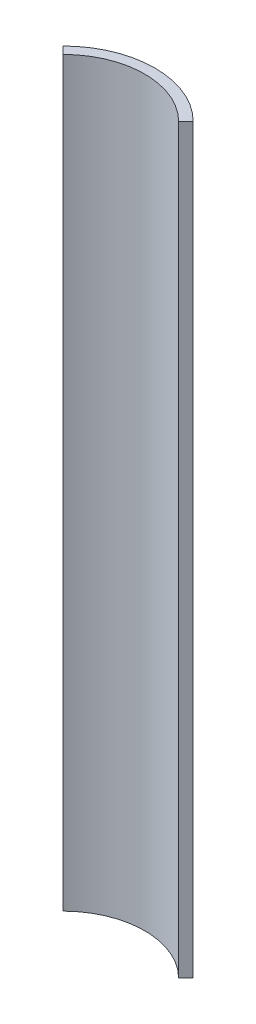
from build123d import *

# Parameters (mm, degrees)
SKETCH1_W          = 6.3754
SKETCH1_H          = 459.987449644
SKETCH6_OUTSIDE_W  = 213.812
SKETCH6_OUTSIDE_H  = 213.812
CUT_EXTRUDE2_DEPTH = 468.033937557


with BuildPart() as part:
    # Sketch1 → Revolve1 (revolve)
    with BuildSketch(Plane.XY):
        with Locations((53.9623, 0)):
            Rectangle(SKETCH1_W, SKETCH1_H)
    revolve(axis=Axis((0, 0, 0), (0, 1, 0)))

    # Sketch6 outside → Cut-Extrude2 (cut, through all)
    with BuildSketch(Plane(origin=(0, 229.993724822, 0), x_dir=(1, 0, 0), z_dir=(0, 1, 0))):
        Rectangle(SKETCH6_OUTSIDE_W, SKETCH6_OUTSIDE_H)
        with BuildLine():
            Line((0, 0), (-40.411152545, 40.411152545))
            ThreePointArc((-40.411152545, 40.411152545), (0, 57.15), (40.411152545, 40.411152545))
            Line((40.411152545, 40.411152545), (0, 0))
        make_face(mode=Mode.SUBTRACT)
    extrude(amount=-CUT_EXTRUDE2_DEPTH, mode=Mode.SUBTRACT)


solid = part.part
